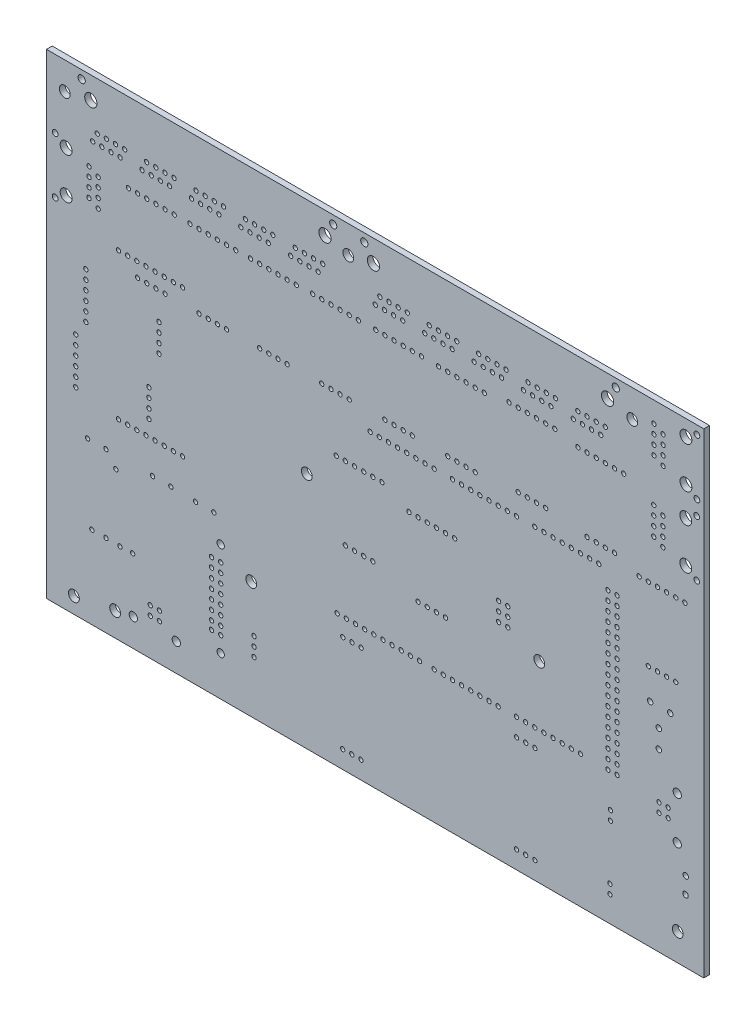
from build123d import *

# Parameters (mm, degrees)
MODEL_W             = 182.5400464
MODEL_H             = 132.08
MODEL_R             = 0.762
MODEL_R_2           = 0.6
MODEL_R_3           = 1.1500104
MODEL_R_4           = 0.999998
MODEL_R_5           = 0.7999984
MODEL_R_6           = 1.499997
MODEL_R_7           = 1.016
MODEL_R_8           = 1.6999966
MODEL_R_9           = 1.6500094
BOSS_EXTRUDE1_DEPTH = 1.6


with BuildPart() as part:
    # Model → Boss-Extrude1 (new body)
    with BuildSketch(Plane.XY):
        with Locations((88.7300232, -66.04)):
            Rectangle(MODEL_W, MODEL_H)
        with Locations((175.0000056, -109.99978)):
            Circle(MODEL_R, mode=Mode.SUBTRACT)
        with Locations((21.3998048, -109.2496926)):
            Circle(MODEL_R_2, mode=Mode.SUBTRACT)
        with Locations((10.0742242, -109.2244196)):
            Circle(MODEL_R_2, mode=Mode.SUBTRACT)
        with Locations((13.9749022, -109.2495402)):
            Circle(MODEL_R_2, mode=Mode.SUBTRACT)
        with Locations((165.1, -73.025)):
            Circle(MODEL_R, mode=Mode.SUBTRACT)
        with Locations((43.307, -99.187)):
            Circle(MODEL_R_2, mode=Mode.SUBTRACT)
        with Locations((43.307, -101.727)):
            Circle(MODEL_R_2, mode=Mode.SUBTRACT)
        with Locations((43.307, -104.267)):
            Circle(MODEL_R_2, mode=Mode.SUBTRACT)
        with Locations((43.307, -106.807)):
            Circle(MODEL_R_2, mode=Mode.SUBTRACT)
        with Locations((43.307, -109.347)):
            Circle(MODEL_R_2, mode=Mode.SUBTRACT)
        with Locations((43.307, -111.887)):
            Circle(MODEL_R_2, mode=Mode.SUBTRACT)
        with Locations((43.307, -114.427)):
            Circle(MODEL_R_2, mode=Mode.SUBTRACT)
        with Locations((43.307, -116.713)):
            Circle(MODEL_R_2, mode=Mode.SUBTRACT)
        with Locations((45.847, -99.187)):
            Circle(MODEL_R_2, mode=Mode.SUBTRACT)
        with Locations((45.847, -101.727)):
            Circle(MODEL_R_2, mode=Mode.SUBTRACT)
        with Locations((45.847, -104.267)):
            Circle(MODEL_R_2, mode=Mode.SUBTRACT)
        with Locations((45.847, -106.807)):
            Circle(MODEL_R_2, mode=Mode.SUBTRACT)
        with Locations((45.847, -109.347)):
            Circle(MODEL_R_2, mode=Mode.SUBTRACT)
        with Locations((45.847, -111.887)):
            Circle(MODEL_R_2, mode=Mode.SUBTRACT)
        with Locations((45.847, -114.427)):
            Circle(MODEL_R_2, mode=Mode.SUBTRACT)
        with Locations((45.847, -116.713)):
            Circle(MODEL_R_2, mode=Mode.SUBTRACT)
        with Locations((19.99996, -78.994)):
            Circle(MODEL_R_2, mode=Mode.SUBTRACT)
        with Locations((22.53996, -78.994)):
            Circle(MODEL_R_2, mode=Mode.SUBTRACT)
        with Locations((25.07996, -78.994)):
            Circle(MODEL_R_2, mode=Mode.SUBTRACT)
        with Locations((27.61996, -78.994)):
            Circle(MODEL_R_2, mode=Mode.SUBTRACT)
        with Locations((30.15996, -78.994)):
            Circle(MODEL_R_2, mode=Mode.SUBTRACT)
        with Locations((32.69996, -78.994)):
            Circle(MODEL_R_2, mode=Mode.SUBTRACT)
        with Locations((35.23996, -78.994)):
            Circle(MODEL_R_2, mode=Mode.SUBTRACT)
        with Locations((19.99996, -38.354)):
            Circle(MODEL_R_2, mode=Mode.SUBTRACT)
        with Locations((22.53996, -38.354)):
            Circle(MODEL_R_2, mode=Mode.SUBTRACT)
        with Locations((25.07996, -38.354)):
            Circle(MODEL_R_2, mode=Mode.SUBTRACT)
        with Locations((27.61996, -38.354)):
            Circle(MODEL_R_2, mode=Mode.SUBTRACT)
        with Locations((30.15996, -38.354)):
            Circle(MODEL_R_2, mode=Mode.SUBTRACT)
        with Locations((32.69996, -38.354)):
            Circle(MODEL_R_2, mode=Mode.SUBTRACT)
        with Locations((35.23996, -38.354)):
            Circle(MODEL_R_2, mode=Mode.SUBTRACT)
        with Locations((167.513, -78.232)):
            Circle(MODEL_R, mode=Mode.SUBTRACT)
        with Locations((167.513, -83.312)):
            Circle(MODEL_R, mode=Mode.SUBTRACT)
        with Locations((135.598789, -47.0198704)):
            Circle(MODEL_R_2, mode=Mode.SUBTRACT)
        with Locations((138.138789, -47.0198704)):
            Circle(MODEL_R_2, mode=Mode.SUBTRACT)
        with Locations((140.678789, -47.0198704)):
            Circle(MODEL_R_2, mode=Mode.SUBTRACT)
        with Locations((143.218789, -47.0198704)):
            Circle(MODEL_R_2, mode=Mode.SUBTRACT)
        with Locations((145.758789, -47.0198704)):
            Circle(MODEL_R_2, mode=Mode.SUBTRACT)
        with Locations((148.298789, -47.0198704)):
            Circle(MODEL_R_2, mode=Mode.SUBTRACT)
        with Locations((150.838789, -47.0198704)):
            Circle(MODEL_R_2, mode=Mode.SUBTRACT)
        with Locations((133.058789, -47.0198704)):
            Circle(MODEL_R_2, mode=Mode.SUBTRACT)
        with Locations((130.518789, -95.2798704)):
            Circle(MODEL_R_2, mode=Mode.SUBTRACT)
        with Locations((133.058789, -95.2798704)):
            Circle(MODEL_R_2, mode=Mode.SUBTRACT)
        with Locations((135.598789, -95.2798704)):
            Circle(MODEL_R_2, mode=Mode.SUBTRACT)
        with Locations((138.138789, -95.2798704)):
            Circle(MODEL_R_2, mode=Mode.SUBTRACT)
        with Locations((140.678789, -95.2798704)):
            Circle(MODEL_R_2, mode=Mode.SUBTRACT)
        with Locations((143.218789, -95.2798704)):
            Circle(MODEL_R_2, mode=Mode.SUBTRACT)
        with Locations((145.758789, -95.2798704)):
            Circle(MODEL_R_2, mode=Mode.SUBTRACT)
        with Locations((127.978789, -95.2798704)):
            Circle(MODEL_R_2, mode=Mode.SUBTRACT)
        with Locations((112.738789, -47.0198704)):
            Circle(MODEL_R_2, mode=Mode.SUBTRACT)
        with Locations((115.278789, -47.0198704)):
            Circle(MODEL_R_2, mode=Mode.SUBTRACT)
        with Locations((117.818789, -47.0198704)):
            Circle(MODEL_R_2, mode=Mode.SUBTRACT)
        with Locations((120.358789, -47.0198704)):
            Circle(MODEL_R_2, mode=Mode.SUBTRACT)
        with Locations((122.898789, -47.0198704)):
            Circle(MODEL_R_2, mode=Mode.SUBTRACT)
        with Locations((125.438789, -47.0198704)):
            Circle(MODEL_R_2, mode=Mode.SUBTRACT)
        with Locations((127.978789, -47.0198704)):
            Circle(MODEL_R_2, mode=Mode.SUBTRACT)
        with Locations((110.198789, -47.0198704)):
            Circle(MODEL_R_2, mode=Mode.SUBTRACT)
        with Locations((107.658789, -95.2798704)):
            Circle(MODEL_R_2, mode=Mode.SUBTRACT)
        with Locations((110.198789, -95.2798704)):
            Circle(MODEL_R_2, mode=Mode.SUBTRACT)
        with Locations((112.738789, -95.2798704)):
            Circle(MODEL_R_2, mode=Mode.SUBTRACT)
        with Locations((115.278789, -95.2798704)):
            Circle(MODEL_R_2, mode=Mode.SUBTRACT)
        with Locations((117.818789, -95.2798704)):
            Circle(MODEL_R_2, mode=Mode.SUBTRACT)
        with Locations((120.358789, -95.2798704)):
            Circle(MODEL_R_2, mode=Mode.SUBTRACT)
        with Locations((122.898789, -95.2798704)):
            Circle(MODEL_R_2, mode=Mode.SUBTRACT)
        with Locations((105.118789, -95.2798704)):
            Circle(MODEL_R_2, mode=Mode.SUBTRACT)
        with Locations((85.814789, -95.2798704)):
            Circle(MODEL_R_2, mode=Mode.SUBTRACT)
        with Locations((88.354789, -95.2798704)):
            Circle(MODEL_R_2, mode=Mode.SUBTRACT)
        with Locations((90.894789, -95.2798704)):
            Circle(MODEL_R_2, mode=Mode.SUBTRACT)
        with Locations((93.434789, -95.2798704)):
            Circle(MODEL_R_2, mode=Mode.SUBTRACT)
        with Locations((95.974789, -95.2798704)):
            Circle(MODEL_R_2, mode=Mode.SUBTRACT)
        with Locations((98.514789, -95.2798704)):
            Circle(MODEL_R_2, mode=Mode.SUBTRACT)
        with Locations((101.054789, -95.2798704)):
            Circle(MODEL_R_2, mode=Mode.SUBTRACT)
        with Locations((83.274789, -95.2798704)):
            Circle(MODEL_R_2, mode=Mode.SUBTRACT)
        with Locations((155.918916, -74.959972)):
            Circle(MODEL_R_2, mode=Mode.SUBTRACT)
        with Locations((153.378916, -74.959972)):
            Circle(MODEL_R_2, mode=Mode.SUBTRACT)
        with Locations((155.918916, -77.499972)):
            Circle(MODEL_R_2, mode=Mode.SUBTRACT)
        with Locations((153.378916, -77.499972)):
            Circle(MODEL_R_2, mode=Mode.SUBTRACT)
        with Locations((155.918916, -80.039972)):
            Circle(MODEL_R_2, mode=Mode.SUBTRACT)
        with Locations((153.378916, -80.039972)):
            Circle(MODEL_R_2, mode=Mode.SUBTRACT)
        with Locations((155.918916, -82.579972)):
            Circle(MODEL_R_2, mode=Mode.SUBTRACT)
        with Locations((153.378916, -82.579972)):
            Circle(MODEL_R_2, mode=Mode.SUBTRACT)
        with Locations((155.918916, -85.119972)):
            Circle(MODEL_R_2, mode=Mode.SUBTRACT)
        with Locations((153.378916, -85.119972)):
            Circle(MODEL_R_2, mode=Mode.SUBTRACT)
        with Locations((155.918916, -87.659972)):
            Circle(MODEL_R_2, mode=Mode.SUBTRACT)
        with Locations((153.378916, -87.659972)):
            Circle(MODEL_R_2, mode=Mode.SUBTRACT)
        with Locations((155.918916, -90.199972)):
            Circle(MODEL_R_2, mode=Mode.SUBTRACT)
        with Locations((153.378916, -90.199972)):
            Circle(MODEL_R_2, mode=Mode.SUBTRACT)
        with Locations((155.918916, -92.739972)):
            Circle(MODEL_R_2, mode=Mode.SUBTRACT)
        with Locations((153.378916, -92.739972)):
            Circle(MODEL_R_2, mode=Mode.SUBTRACT)
        with Locations((155.918916, -54.639972)):
            Circle(MODEL_R_2, mode=Mode.SUBTRACT)
        with Locations((153.378916, -54.639972)):
            Circle(MODEL_R_2, mode=Mode.SUBTRACT)
        with Locations((155.918916, -57.179972)):
            Circle(MODEL_R_2, mode=Mode.SUBTRACT)
        with Locations((153.378916, -57.179972)):
            Circle(MODEL_R_2, mode=Mode.SUBTRACT)
        with Locations((155.918916, -59.719972)):
            Circle(MODEL_R_2, mode=Mode.SUBTRACT)
        with Locations((153.378916, -59.719972)):
            Circle(MODEL_R_2, mode=Mode.SUBTRACT)
        with Locations((155.918916, -62.259972)):
            Circle(MODEL_R_2, mode=Mode.SUBTRACT)
        with Locations((153.378916, -62.259972)):
            Circle(MODEL_R_2, mode=Mode.SUBTRACT)
        with Locations((155.918916, -64.799972)):
            Circle(MODEL_R_2, mode=Mode.SUBTRACT)
        with Locations((153.378916, -64.799972)):
            Circle(MODEL_R_2, mode=Mode.SUBTRACT)
        with Locations((155.918916, -67.339972)):
            Circle(MODEL_R_2, mode=Mode.SUBTRACT)
        with Locations((153.378916, -67.339972)):
            Circle(MODEL_R_2, mode=Mode.SUBTRACT)
        with Locations((155.918916, -69.879972)):
            Circle(MODEL_R_2, mode=Mode.SUBTRACT)
        with Locations((153.378916, -69.879972)):
            Circle(MODEL_R_2, mode=Mode.SUBTRACT)
        with Locations((155.918916, -72.419972)):
            Circle(MODEL_R_2, mode=Mode.SUBTRACT)
        with Locations((153.378916, -72.419972)):
            Circle(MODEL_R_2, mode=Mode.SUBTRACT)
        with Locations((153.378789, -52.0998704)):
            Circle(MODEL_R_2, mode=Mode.SUBTRACT)
        with Locations((155.918789, -52.0998704)):
            Circle(MODEL_R_2, mode=Mode.SUBTRACT)
        with Locations((153.378789, -95.2798704)):
            Circle(MODEL_R_2, mode=Mode.SUBTRACT)
        with Locations((155.918789, -95.2798704)):
            Circle(MODEL_R_2, mode=Mode.SUBTRACT)
        with Locations((92.418789, -47.0198704)):
            Circle(MODEL_R_2, mode=Mode.SUBTRACT)
        with Locations((94.958789, -47.0198704)):
            Circle(MODEL_R_2, mode=Mode.SUBTRACT)
        with Locations((97.498789, -47.0198704)):
            Circle(MODEL_R_2, mode=Mode.SUBTRACT)
        with Locations((100.038789, -47.0198704)):
            Circle(MODEL_R_2, mode=Mode.SUBTRACT)
        with Locations((102.578789, -47.0198704)):
            Circle(MODEL_R_2, mode=Mode.SUBTRACT)
        with Locations((105.118789, -47.0198704)):
            Circle(MODEL_R_2, mode=Mode.SUBTRACT)
        with Locations((80.734789, -95.2798704)):
            Circle(MODEL_R_2, mode=Mode.SUBTRACT)
        with Locations((78.194789, -95.2798704)):
            Circle(MODEL_R_2, mode=Mode.SUBTRACT)
        with Locations((87.338789, -47.0198704)):
            Circle(MODEL_R_2, mode=Mode.SUBTRACT)
        with Locations((89.878789, -47.0198704)):
            Circle(MODEL_R_2, mode=Mode.SUBTRACT)
        with Locations((123.025789, -74.9598704)):
            Circle(MODEL_R_2, mode=Mode.SUBTRACT)
        with Locations((125.565789, -74.9598704)):
            Circle(MODEL_R_2, mode=Mode.SUBTRACT)
        with Locations((123.025789, -72.4198704)):
            Circle(MODEL_R_2, mode=Mode.SUBTRACT)
        with Locations((125.565789, -72.4198704)):
            Circle(MODEL_R_2, mode=Mode.SUBTRACT)
        with Locations((123.025789, -69.8798704)):
            Circle(MODEL_R_2, mode=Mode.SUBTRACT)
        with Locations((125.565789, -69.8798704)):
            Circle(MODEL_R_2, mode=Mode.SUBTRACT)
        with Locations((55.118, -117.348)):
            Circle(MODEL_R_2, mode=Mode.SUBTRACT)
        with Locations((55.118, -114.808)):
            Circle(MODEL_R_2, mode=Mode.SUBTRACT)
        with Locations((55.118, -112.268)):
            Circle(MODEL_R_2, mode=Mode.SUBTRACT)
        with Locations((154.073863065, -104.652526682)):
            Circle(MODEL_R_2, mode=Mode.SUBTRACT)
        with Locations((154.073863065, -107.192526682)):
            Circle(MODEL_R_2, mode=Mode.SUBTRACT)
        with Locations((153.946863065, -124.972526682)):
            Circle(MODEL_R_2, mode=Mode.SUBTRACT)
        with Locations((153.946863065, -122.432526682)):
            Circle(MODEL_R_2, mode=Mode.SUBTRACT)
        with Locations((127.993533681, -127.161364817)):
            Circle(MODEL_R_2, mode=Mode.SUBTRACT)
        with Locations((130.533533681, -127.161364817)):
            Circle(MODEL_R_2, mode=Mode.SUBTRACT)
        with Locations((133.096, -127.159)):
            Circle(MODEL_R_2, mode=Mode.SUBTRACT)
        with Locations((133.096, -100.203)):
            Circle(MODEL_R_2, mode=Mode.SUBTRACT)
        with Locations((130.556, -100.203)):
            Circle(MODEL_R_2, mode=Mode.SUBTRACT)
        with Locations((128.016, -100.203)):
            Circle(MODEL_R_2, mode=Mode.SUBTRACT)
        with Locations((84.788420472, -127.165668365)):
            Circle(MODEL_R_2, mode=Mode.SUBTRACT)
        with Locations((82.248420472, -127.165668365)):
            Circle(MODEL_R_2, mode=Mode.SUBTRACT)
        with Locations((79.708420472, -127.165668365)):
            Circle(MODEL_R_2, mode=Mode.SUBTRACT)
        with Locations((84.836, -100.203)):
            Circle(MODEL_R_2, mode=Mode.SUBTRACT)
        with Locations((82.296, -100.203)):
            Circle(MODEL_R_2, mode=Mode.SUBTRACT)
        with Locations((79.756, -100.203)):
            Circle(MODEL_R_2, mode=Mode.SUBTRACT)
        with Locations((43.942, -88.138)):
            Circle(MODEL_R_2, mode=Mode.SUBTRACT)
        with Locations((38.862, -88.138)):
            Circle(MODEL_R_2, mode=Mode.SUBTRACT)
        with Locations((170.0996598, -98.5698054)):
            Circle(MODEL_R_2, mode=Mode.SUBTRACT)
        with Locations((167.5596598, -98.5698054)):
            Circle(MODEL_R_2, mode=Mode.SUBTRACT)
        with Locations((170.0996598, -96.0298054)):
            Circle(MODEL_R_2, mode=Mode.SUBTRACT)
        with Locations((172.6396598, -91.3308054)):
            Circle(MODEL_R_3, mode=Mode.SUBTRACT)
        with Locations((172.6396598, -103.2688054)):
            Circle(MODEL_R_3, mode=Mode.SUBTRACT)
        with Locations((26.279856, -121.82475)):
            Circle(MODEL_R_2, mode=Mode.SUBTRACT)
        with Locations((26.2799576, -119.28475)):
            Circle(MODEL_R_2, mode=Mode.SUBTRACT)
        with Locations((28.8199576, -121.82475)):
            Circle(MODEL_R_2, mode=Mode.SUBTRACT)
        with Locations((33.5189576, -124.36475)):
            Circle(MODEL_R_3, mode=Mode.SUBTRACT)
        with Locations((21.5809576, -124.36475)):
            Circle(MODEL_R_3, mode=Mode.SUBTRACT)
        with Locations((8.89, -87.884)):
            Circle(MODEL_R_2, mode=Mode.SUBTRACT)
        with Locations((13.97, -87.884)):
            Circle(MODEL_R_2, mode=Mode.SUBTRACT)
        with Locations((26.924, -87.884)):
            Circle(MODEL_R_2, mode=Mode.SUBTRACT)
        with Locations((32.004, -87.884)):
            Circle(MODEL_R_2, mode=Mode.SUBTRACT)
        with Locations((10.2869492, -15.7478984)):
            Circle(MODEL_R_2, mode=Mode.SUBTRACT)
        with Locations((11.5569492, -13.2078984)):
            Circle(MODEL_R_2, mode=Mode.SUBTRACT)
        with Locations((12.8269492, -15.7478984)):
            Circle(MODEL_R_2, mode=Mode.SUBTRACT)
        with Locations((14.0969492, -13.2078984)):
            Circle(MODEL_R_2, mode=Mode.SUBTRACT)
        with Locations((15.3669492, -15.7478984)):
            Circle(MODEL_R_2, mode=Mode.SUBTRACT)
        with Locations((16.6369492, -13.2078984)):
            Circle(MODEL_R_2, mode=Mode.SUBTRACT)
        with Locations((17.9069492, -15.7478984)):
            Circle(MODEL_R_2, mode=Mode.SUBTRACT)
        with Locations((19.1769492, -13.2078984)):
            Circle(MODEL_R_2, mode=Mode.SUBTRACT)
        with Locations((24.0029492, -15.7478984)):
            Circle(MODEL_R_2, mode=Mode.SUBTRACT)
        with Locations((25.2729492, -13.2078984)):
            Circle(MODEL_R_2, mode=Mode.SUBTRACT)
        with Locations((26.5429492, -15.7478984)):
            Circle(MODEL_R_2, mode=Mode.SUBTRACT)
        with Locations((27.8129492, -13.2078984)):
            Circle(MODEL_R_2, mode=Mode.SUBTRACT)
        with Locations((29.083, -15.748)):
            Circle(MODEL_R_2, mode=Mode.SUBTRACT)
        with Locations((30.3529492, -13.2078984)):
            Circle(MODEL_R_2, mode=Mode.SUBTRACT)
        with Locations((31.6229492, -15.7478984)):
            Circle(MODEL_R_2, mode=Mode.SUBTRACT)
        with Locations((32.8929492, -13.2078984)):
            Circle(MODEL_R_2, mode=Mode.SUBTRACT)
        with Locations((37.7189492, -15.7478984)):
            Circle(MODEL_R_2, mode=Mode.SUBTRACT)
        with Locations((38.9889492, -13.2078984)):
            Circle(MODEL_R_2, mode=Mode.SUBTRACT)
        with Locations((40.2589492, -15.7478984)):
            Circle(MODEL_R_2, mode=Mode.SUBTRACT)
        with Locations((41.5289492, -13.2078984)):
            Circle(MODEL_R_2, mode=Mode.SUBTRACT)
        with Locations((42.7989492, -15.7478984)):
            Circle(MODEL_R_2, mode=Mode.SUBTRACT)
        with Locations((44.0689492, -13.2078984)):
            Circle(MODEL_R_2, mode=Mode.SUBTRACT)
        with Locations((45.3389492, -15.7478984)):
            Circle(MODEL_R_2, mode=Mode.SUBTRACT)
        with Locations((46.6089492, -13.2078984)):
            Circle(MODEL_R_2, mode=Mode.SUBTRACT)
        with Locations((51.4349492, -15.7478984)):
            Circle(MODEL_R_2, mode=Mode.SUBTRACT)
        with Locations((52.7049492, -13.2078984)):
            Circle(MODEL_R_2, mode=Mode.SUBTRACT)
        with Locations((53.9749492, -15.7478984)):
            Circle(MODEL_R_2, mode=Mode.SUBTRACT)
        with Locations((55.2449492, -13.2078984)):
            Circle(MODEL_R_2, mode=Mode.SUBTRACT)
        with Locations((56.5149492, -15.7478984)):
            Circle(MODEL_R_2, mode=Mode.SUBTRACT)
        with Locations((57.7849492, -13.2078984)):
            Circle(MODEL_R_2, mode=Mode.SUBTRACT)
        with Locations((59.0549492, -15.7478984)):
            Circle(MODEL_R_2, mode=Mode.SUBTRACT)
        with Locations((60.3249492, -13.2078984)):
            Circle(MODEL_R_2, mode=Mode.SUBTRACT)
        with Locations((7.2389492, -2.2858984)):
            Circle(MODEL_R_4, mode=Mode.SUBTRACT)
        with Locations((77.0889492, -2.2858984)):
            Circle(MODEL_R_4, mode=Mode.SUBTRACT)
        with Locations((74.1679746, -13.208)):
            Circle(MODEL_R_2, mode=Mode.SUBTRACT)
        with Locations((72.8979746, -15.748)):
            Circle(MODEL_R_2, mode=Mode.SUBTRACT)
        with Locations((71.6279746, -13.208)):
            Circle(MODEL_R_2, mode=Mode.SUBTRACT)
        with Locations((70.3579746, -15.748)):
            Circle(MODEL_R_2, mode=Mode.SUBTRACT)
        with Locations((69.0879746, -13.208)):
            Circle(MODEL_R_2, mode=Mode.SUBTRACT)
        with Locations((67.8179746, -15.748)):
            Circle(MODEL_R_2, mode=Mode.SUBTRACT)
        with Locations((66.5479746, -13.208)):
            Circle(MODEL_R_2, mode=Mode.SUBTRACT)
        with Locations((65.2779746, -15.748)):
            Circle(MODEL_R_2, mode=Mode.SUBTRACT)
        with Locations((88.7729492, -15.7478984)):
            Circle(MODEL_R_2, mode=Mode.SUBTRACT)
        with Locations((90.0429492, -13.2078984)):
            Circle(MODEL_R_2, mode=Mode.SUBTRACT)
        with Locations((91.3129492, -15.7478984)):
            Circle(MODEL_R_2, mode=Mode.SUBTRACT)
        with Locations((92.5829492, -13.2078984)):
            Circle(MODEL_R_2, mode=Mode.SUBTRACT)
        with Locations((93.8529492, -15.7478984)):
            Circle(MODEL_R_2, mode=Mode.SUBTRACT)
        with Locations((95.1229492, -13.2078984)):
            Circle(MODEL_R_2, mode=Mode.SUBTRACT)
        with Locations((96.3929492, -15.7478984)):
            Circle(MODEL_R_2, mode=Mode.SUBTRACT)
        with Locations((97.6629492, -13.2078984)):
            Circle(MODEL_R_2, mode=Mode.SUBTRACT)
        with Locations((102.4889492, -15.7478984)):
            Circle(MODEL_R_2, mode=Mode.SUBTRACT)
        with Locations((103.7589492, -13.2078984)):
            Circle(MODEL_R_2, mode=Mode.SUBTRACT)
        with Locations((105.0289492, -15.7478984)):
            Circle(MODEL_R_2, mode=Mode.SUBTRACT)
        with Locations((106.2989492, -13.2078984)):
            Circle(MODEL_R_2, mode=Mode.SUBTRACT)
        with Locations((107.5689492, -15.7478984)):
            Circle(MODEL_R_2, mode=Mode.SUBTRACT)
        with Locations((108.8389492, -13.2078984)):
            Circle(MODEL_R_2, mode=Mode.SUBTRACT)
        with Locations((110.1089492, -15.7478984)):
            Circle(MODEL_R_2, mode=Mode.SUBTRACT)
        with Locations((111.3789492, -13.2078984)):
            Circle(MODEL_R_2, mode=Mode.SUBTRACT)
        with Locations((116.2049492, -15.7478984)):
            Circle(MODEL_R_2, mode=Mode.SUBTRACT)
        with Locations((117.4749492, -13.2078984)):
            Circle(MODEL_R_2, mode=Mode.SUBTRACT)
        with Locations((118.7449492, -15.7478984)):
            Circle(MODEL_R_2, mode=Mode.SUBTRACT)
        with Locations((120.0149492, -13.2078984)):
            Circle(MODEL_R_2, mode=Mode.SUBTRACT)
        with Locations((121.2849492, -15.7478984)):
            Circle(MODEL_R_2, mode=Mode.SUBTRACT)
        with Locations((122.5549492, -13.2078984)):
            Circle(MODEL_R_2, mode=Mode.SUBTRACT)
        with Locations((123.8249492, -15.7478984)):
            Circle(MODEL_R_2, mode=Mode.SUBTRACT)
        with Locations((125.0949492, -13.2078984)):
            Circle(MODEL_R_2, mode=Mode.SUBTRACT)
        with Locations((129.9209492, -15.7478984)):
            Circle(MODEL_R_2, mode=Mode.SUBTRACT)
        with Locations((131.1909492, -13.2078984)):
            Circle(MODEL_R_2, mode=Mode.SUBTRACT)
        with Locations((132.4609492, -15.7478984)):
            Circle(MODEL_R_2, mode=Mode.SUBTRACT)
        with Locations((133.7309492, -13.2078984)):
            Circle(MODEL_R_2, mode=Mode.SUBTRACT)
        with Locations((135.0009492, -15.7478984)):
            Circle(MODEL_R_2, mode=Mode.SUBTRACT)
        with Locations((136.2709492, -13.2078984)):
            Circle(MODEL_R_2, mode=Mode.SUBTRACT)
        with Locations((137.5409492, -15.7478984)):
            Circle(MODEL_R_2, mode=Mode.SUBTRACT)
        with Locations((138.8109492, -13.2078984)):
            Circle(MODEL_R_2, mode=Mode.SUBTRACT)
        with Locations((85.7249492, -2.2858984)):
            Circle(MODEL_R_4, mode=Mode.SUBTRACT)
        with Locations((155.5749492, -2.2858984)):
            Circle(MODEL_R_4, mode=Mode.SUBTRACT)
        with Locations((152.6539746, -13.208)):
            Circle(MODEL_R_2, mode=Mode.SUBTRACT)
        with Locations((151.3839746, -15.748)):
            Circle(MODEL_R_2, mode=Mode.SUBTRACT)
        with Locations((150.1139746, -13.208)):
            Circle(MODEL_R_2, mode=Mode.SUBTRACT)
        with Locations((148.8439746, -15.748)):
            Circle(MODEL_R_2, mode=Mode.SUBTRACT)
        with Locations((147.5739746, -13.208)):
            Circle(MODEL_R_2, mode=Mode.SUBTRACT)
        with Locations((146.3039746, -15.748)):
            Circle(MODEL_R_2, mode=Mode.SUBTRACT)
        with Locations((145.0339746, -13.208)):
            Circle(MODEL_R_2, mode=Mode.SUBTRACT)
        with Locations((143.7639746, -15.748)):
            Circle(MODEL_R_2, mode=Mode.SUBTRACT)
        with Locations((168.6946334, -14.5699734)):
            Circle(MODEL_R_2, mode=Mode.SUBTRACT)
        with Locations((166.1546334, -13.2999734)):
            Circle(MODEL_R_2, mode=Mode.SUBTRACT)
        with Locations((168.6946334, -12.0299734)):
            Circle(MODEL_R_2, mode=Mode.SUBTRACT)
        with Locations((166.1546334, -10.7599734)):
            Circle(MODEL_R_2, mode=Mode.SUBTRACT)
        with Locations((168.6946334, -9.4899734)):
            Circle(MODEL_R_2, mode=Mode.SUBTRACT)
        with Locations((166.1546334, -8.2199734)):
            Circle(MODEL_R_2, mode=Mode.SUBTRACT)
        with Locations((168.6946334, -6.9499734)):
            Circle(MODEL_R_2, mode=Mode.SUBTRACT)
        with Locations((166.1546334, -5.6799734)):
            Circle(MODEL_R_2, mode=Mode.SUBTRACT)
        with Locations((178.09464, -2.3749762)):
            Circle(MODEL_R_5, mode=Mode.SUBTRACT)
        with Locations((178.09464, -17.8749706)):
            Circle(MODEL_R_5, mode=Mode.SUBTRACT)
        with Locations((168.6446462, -34.1449406)):
            Circle(MODEL_R_2, mode=Mode.SUBTRACT)
        with Locations((166.1046462, -32.8749406)):
            Circle(MODEL_R_2, mode=Mode.SUBTRACT)
        with Locations((168.6446462, -31.6049406)):
            Circle(MODEL_R_2, mode=Mode.SUBTRACT)
        with Locations((166.1046462, -30.3349406)):
            Circle(MODEL_R_2, mode=Mode.SUBTRACT)
        with Locations((168.6446462, -29.0649406)):
            Circle(MODEL_R_2, mode=Mode.SUBTRACT)
        with Locations((166.1046462, -27.7949406)):
            Circle(MODEL_R_2, mode=Mode.SUBTRACT)
        with Locations((168.6446462, -26.5249406)):
            Circle(MODEL_R_2, mode=Mode.SUBTRACT)
        with Locations((166.1046462, -25.2549406)):
            Circle(MODEL_R_2, mode=Mode.SUBTRACT)
        with Locations((178.0446528, -21.9499434)):
            Circle(MODEL_R_5, mode=Mode.SUBTRACT)
        with Locations((178.0446528, -37.4499378)):
            Circle(MODEL_R_5, mode=Mode.SUBTRACT)
        with Locations((9.272016, -22.225)):
            Circle(MODEL_R_2, mode=Mode.SUBTRACT)
        with Locations((11.812016, -23.495)):
            Circle(MODEL_R_2, mode=Mode.SUBTRACT)
        with Locations((9.272016, -24.765)):
            Circle(MODEL_R_2, mode=Mode.SUBTRACT)
        with Locations((11.812016, -26.035)):
            Circle(MODEL_R_2, mode=Mode.SUBTRACT)
        with Locations((9.272016, -27.305)):
            Circle(MODEL_R_2, mode=Mode.SUBTRACT)
        with Locations((11.812016, -28.575)):
            Circle(MODEL_R_2, mode=Mode.SUBTRACT)
        with Locations((9.272016, -29.845)):
            Circle(MODEL_R_2, mode=Mode.SUBTRACT)
        with Locations((11.812016, -31.115)):
            Circle(MODEL_R_2, mode=Mode.SUBTRACT)
        with Locations((-0.1279906, -34.4199972)):
            Circle(MODEL_R_5, mode=Mode.SUBTRACT)
        with Locations((-0.1279906, -18.9200028)):
            Circle(MODEL_R_5, mode=Mode.SUBTRACT)
        with Locations((28.7199832, -52.4799052)):
            Circle(MODEL_R_2, mode=Mode.SUBTRACT)
        with Locations((28.7199832, -55.0199052)):
            Circle(MODEL_R_2, mode=Mode.SUBTRACT)
        with Locations((28.7199832, -57.5599052)):
            Circle(MODEL_R_2, mode=Mode.SUBTRACT)
        with Locations((8.3999832, -47.3999052)):
            Circle(MODEL_R_2, mode=Mode.SUBTRACT)
        with Locations((8.3999832, -49.9399052)):
            Circle(MODEL_R_2, mode=Mode.SUBTRACT)
        with Locations((8.3999832, -52.4799052)):
            Circle(MODEL_R_2, mode=Mode.SUBTRACT)
        with Locations((8.3999832, -55.0199052)):
            Circle(MODEL_R_2, mode=Mode.SUBTRACT)
        with Locations((8.3999832, -57.5599052)):
            Circle(MODEL_R_2, mode=Mode.SUBTRACT)
        with Locations((27.8449278, -42.319956)):
            Circle(MODEL_R_2, mode=Mode.SUBTRACT)
        with Locations((25.3049278, -42.319956)):
            Circle(MODEL_R_2, mode=Mode.SUBTRACT)
        with Locations((22.7649278, -42.319956)):
            Circle(MODEL_R_2, mode=Mode.SUBTRACT)
        with Locations((32.9249278, -21.999956)):
            Circle(MODEL_R_2, mode=Mode.SUBTRACT)
        with Locations((30.3849278, -21.999956)):
            Circle(MODEL_R_2, mode=Mode.SUBTRACT)
        with Locations((27.8449278, -21.999956)):
            Circle(MODEL_R_2, mode=Mode.SUBTRACT)
        with Locations((25.3049278, -21.999956)):
            Circle(MODEL_R_2, mode=Mode.SUBTRACT)
        with Locations((22.7649278, -21.999956)):
            Circle(MODEL_R_2, mode=Mode.SUBTRACT)
        with Locations((44.9199, -42.3449496)):
            Circle(MODEL_R_2, mode=Mode.SUBTRACT)
        with Locations((42.3799, -42.3449496)):
            Circle(MODEL_R_2, mode=Mode.SUBTRACT)
        with Locations((39.8399, -42.3449496)):
            Circle(MODEL_R_2, mode=Mode.SUBTRACT)
        with Locations((49.9999, -22.0249496)):
            Circle(MODEL_R_2, mode=Mode.SUBTRACT)
        with Locations((47.4599, -22.0249496)):
            Circle(MODEL_R_2, mode=Mode.SUBTRACT)
        with Locations((44.9199, -22.0249496)):
            Circle(MODEL_R_2, mode=Mode.SUBTRACT)
        with Locations((42.3799, -22.0249496)):
            Circle(MODEL_R_2, mode=Mode.SUBTRACT)
        with Locations((39.8399, -22.0249496)):
            Circle(MODEL_R_2, mode=Mode.SUBTRACT)
        with Locations((61.74486, -42.2949624)):
            Circle(MODEL_R_2, mode=Mode.SUBTRACT)
        with Locations((59.20486, -42.2949624)):
            Circle(MODEL_R_2, mode=Mode.SUBTRACT)
        with Locations((56.66486, -42.2949624)):
            Circle(MODEL_R_2, mode=Mode.SUBTRACT)
        with Locations((66.82486, -21.9749624)):
            Circle(MODEL_R_2, mode=Mode.SUBTRACT)
        with Locations((64.28486, -21.9749624)):
            Circle(MODEL_R_2, mode=Mode.SUBTRACT)
        with Locations((61.74486, -21.9749624)):
            Circle(MODEL_R_2, mode=Mode.SUBTRACT)
        with Locations((59.20486, -21.9749624)):
            Circle(MODEL_R_2, mode=Mode.SUBTRACT)
        with Locations((56.66486, -21.9749624)):
            Circle(MODEL_R_2, mode=Mode.SUBTRACT)
        with Locations((78.9948382, -42.169969)):
            Circle(MODEL_R_2, mode=Mode.SUBTRACT)
        with Locations((76.4548382, -42.169969)):
            Circle(MODEL_R_2, mode=Mode.SUBTRACT)
        with Locations((73.9148382, -42.169969)):
            Circle(MODEL_R_2, mode=Mode.SUBTRACT)
        with Locations((84.0748382, -21.849969)):
            Circle(MODEL_R_2, mode=Mode.SUBTRACT)
        with Locations((81.5348382, -21.849969)):
            Circle(MODEL_R_2, mode=Mode.SUBTRACT)
        with Locations((78.9948382, -21.849969)):
            Circle(MODEL_R_2, mode=Mode.SUBTRACT)
        with Locations((76.4548382, -21.849969)):
            Circle(MODEL_R_2, mode=Mode.SUBTRACT)
        with Locations((73.9148382, -21.849969)):
            Circle(MODEL_R_2, mode=Mode.SUBTRACT)
        with Locations((96.5197968, -42.0699692)):
            Circle(MODEL_R_2, mode=Mode.SUBTRACT)
        with Locations((93.9797968, -42.0699692)):
            Circle(MODEL_R_2, mode=Mode.SUBTRACT)
        with Locations((91.4397968, -42.0699692)):
            Circle(MODEL_R_2, mode=Mode.SUBTRACT)
        with Locations((101.5997968, -21.7499692)):
            Circle(MODEL_R_2, mode=Mode.SUBTRACT)
        with Locations((99.0597968, -21.7499692)):
            Circle(MODEL_R_2, mode=Mode.SUBTRACT)
        with Locations((96.5197968, -21.7499692)):
            Circle(MODEL_R_2, mode=Mode.SUBTRACT)
        with Locations((93.9797968, -21.7499692)):
            Circle(MODEL_R_2, mode=Mode.SUBTRACT)
        with Locations((91.4397968, -21.7499692)):
            Circle(MODEL_R_2, mode=Mode.SUBTRACT)
        with Locations((113.9697746, -42.14495)):
            Circle(MODEL_R_2, mode=Mode.SUBTRACT)
        with Locations((111.4297746, -42.14495)):
            Circle(MODEL_R_2, mode=Mode.SUBTRACT)
        with Locations((108.8897746, -42.14495)):
            Circle(MODEL_R_2, mode=Mode.SUBTRACT)
        with Locations((119.0497746, -21.82495)):
            Circle(MODEL_R_2, mode=Mode.SUBTRACT)
        with Locations((116.5097746, -21.82495)):
            Circle(MODEL_R_2, mode=Mode.SUBTRACT)
        with Locations((113.9697746, -21.82495)):
            Circle(MODEL_R_2, mode=Mode.SUBTRACT)
        with Locations((111.4297746, -21.82495)):
            Circle(MODEL_R_2, mode=Mode.SUBTRACT)
        with Locations((108.8897746, -21.82495)):
            Circle(MODEL_R_2, mode=Mode.SUBTRACT)
        with Locations((85.5448124, -77.819885)):
            Circle(MODEL_R_2, mode=Mode.SUBTRACT)
        with Locations((83.0048124, -77.819885)):
            Circle(MODEL_R_2, mode=Mode.SUBTRACT)
        with Locations((80.4648124, -77.819885)):
            Circle(MODEL_R_2, mode=Mode.SUBTRACT)
        with Locations((90.6248124, -57.499885)):
            Circle(MODEL_R_2, mode=Mode.SUBTRACT)
        with Locations((88.0848124, -57.499885)):
            Circle(MODEL_R_2, mode=Mode.SUBTRACT)
        with Locations((85.5448124, -57.499885)):
            Circle(MODEL_R_2, mode=Mode.SUBTRACT)
        with Locations((83.0048124, -57.499885)):
            Circle(MODEL_R_2, mode=Mode.SUBTRACT)
        with Locations((80.4648124, -57.499885)):
            Circle(MODEL_R_2, mode=Mode.SUBTRACT)
        with Locations((133.5447164, -40.994965)):
            Circle(MODEL_R_2, mode=Mode.SUBTRACT)
        with Locations((131.0047164, -40.994965)):
            Circle(MODEL_R_2, mode=Mode.SUBTRACT)
        with Locations((128.4647164, -40.994965)):
            Circle(MODEL_R_2, mode=Mode.SUBTRACT)
        with Locations((138.6247164, -20.674965)):
            Circle(MODEL_R_2, mode=Mode.SUBTRACT)
        with Locations((136.0847164, -20.674965)):
            Circle(MODEL_R_2, mode=Mode.SUBTRACT)
        with Locations((133.5447164, -20.674965)):
            Circle(MODEL_R_2, mode=Mode.SUBTRACT)
        with Locations((131.0047164, -20.674965)):
            Circle(MODEL_R_2, mode=Mode.SUBTRACT)
        with Locations((128.4647164, -20.674965)):
            Circle(MODEL_R_2, mode=Mode.SUBTRACT)
        with Locations((105.744772, -81.2448718)):
            Circle(MODEL_R_2, mode=Mode.SUBTRACT)
        with Locations((103.204772, -81.2448718)):
            Circle(MODEL_R_2, mode=Mode.SUBTRACT)
        with Locations((100.664772, -81.2448718)):
            Circle(MODEL_R_2, mode=Mode.SUBTRACT)
        with Locations((110.824772, -60.9248718)):
            Circle(MODEL_R_2, mode=Mode.SUBTRACT)
        with Locations((108.284772, -60.9248718)):
            Circle(MODEL_R_2, mode=Mode.SUBTRACT)
        with Locations((105.744772, -60.9248718)):
            Circle(MODEL_R_2, mode=Mode.SUBTRACT)
        with Locations((103.204772, -60.9248718)):
            Circle(MODEL_R_2, mode=Mode.SUBTRACT)
        with Locations((100.664772, -60.9248718)):
            Circle(MODEL_R_2, mode=Mode.SUBTRACT)
        with Locations((152.6696972, -42.2199562)):
            Circle(MODEL_R_2, mode=Mode.SUBTRACT)
        with Locations((150.1296972, -42.2199562)):
            Circle(MODEL_R_2, mode=Mode.SUBTRACT)
        with Locations((147.5896972, -42.2199562)):
            Circle(MODEL_R_2, mode=Mode.SUBTRACT)
        with Locations((157.7496972, -21.8999562)):
            Circle(MODEL_R_2, mode=Mode.SUBTRACT)
        with Locations((155.2096972, -21.8999562)):
            Circle(MODEL_R_2, mode=Mode.SUBTRACT)
        with Locations((152.6696972, -21.8999562)):
            Circle(MODEL_R_2, mode=Mode.SUBTRACT)
        with Locations((150.1296972, -21.8999562)):
            Circle(MODEL_R_2, mode=Mode.SUBTRACT)
        with Locations((147.5896972, -21.8999562)):
            Circle(MODEL_R_2, mode=Mode.SUBTRACT)
        with Locations((169.672, -64.77)):
            Circle(MODEL_R_2, mode=Mode.SUBTRACT)
        with Locations((167.132, -64.77)):
            Circle(MODEL_R_2, mode=Mode.SUBTRACT)
        with Locations((164.592, -64.77)):
            Circle(MODEL_R_2, mode=Mode.SUBTRACT)
        with Locations((174.752, -44.45)):
            Circle(MODEL_R_2, mode=Mode.SUBTRACT)
        with Locations((172.212, -44.45)):
            Circle(MODEL_R_2, mode=Mode.SUBTRACT)
        with Locations((169.672, -44.45)):
            Circle(MODEL_R_2, mode=Mode.SUBTRACT)
        with Locations((167.132, -44.45)):
            Circle(MODEL_R_2, mode=Mode.SUBTRACT)
        with Locations((164.592, -44.45)):
            Circle(MODEL_R_2, mode=Mode.SUBTRACT)
        with Locations((25.908, -69.596)):
            Circle(MODEL_R_2, mode=Mode.SUBTRACT)
        with Locations((25.908, -72.136)):
            Circle(MODEL_R_2, mode=Mode.SUBTRACT)
        with Locations((25.908, -74.676)):
            Circle(MODEL_R_2, mode=Mode.SUBTRACT)
        with Locations((5.588, -64.516)):
            Circle(MODEL_R_2, mode=Mode.SUBTRACT)
        with Locations((5.588, -67.056)):
            Circle(MODEL_R_2, mode=Mode.SUBTRACT)
        with Locations((5.588, -69.596)):
            Circle(MODEL_R_2, mode=Mode.SUBTRACT)
        with Locations((5.588, -72.136)):
            Circle(MODEL_R_2, mode=Mode.SUBTRACT)
        with Locations((5.588, -74.676)):
            Circle(MODEL_R_2, mode=Mode.SUBTRACT)
        with Locations((17.8748436, -109.349286)):
            Circle(MODEL_R_2, mode=Mode.SUBTRACT)
        with Locations((174.924593, -114.5748026)):
            Circle(MODEL_R, mode=Mode.SUBTRACT)
        with Locations((170.6880508, -73.0249746)):
            Circle(MODEL_R, mode=Mode.SUBTRACT)
        with Locations((17.45996, -78.994)):
            Circle(MODEL_R_2, mode=Mode.SUBTRACT)
        with Locations((17.45996, -38.354)):
            Circle(MODEL_R_2, mode=Mode.SUBTRACT)
        with Locations((167.5596598, -96.0298054)):
            Circle(MODEL_R_2, mode=Mode.SUBTRACT)
        with Locations((28.8199576, -119.28475)):
            Circle(MODEL_R_2, mode=Mode.SUBTRACT)
        with Locations((28.7199832, -49.9399052)):
            Circle(MODEL_R_2, mode=Mode.SUBTRACT)
        with Locations((8.3999832, -60.0999052)):
            Circle(MODEL_R_2, mode=Mode.SUBTRACT)
        with Locations((30.3849278, -42.319956)):
            Circle(MODEL_R_2, mode=Mode.SUBTRACT)
        with Locations((20.2249278, -21.999956)):
            Circle(MODEL_R_2, mode=Mode.SUBTRACT)
        with Locations((47.4599, -42.3449496)):
            Circle(MODEL_R_2, mode=Mode.SUBTRACT)
        with Locations((37.2999, -22.0249496)):
            Circle(MODEL_R_2, mode=Mode.SUBTRACT)
        with Locations((64.28486, -42.2949624)):
            Circle(MODEL_R_2, mode=Mode.SUBTRACT)
        with Locations((54.12486, -21.9749624)):
            Circle(MODEL_R_2, mode=Mode.SUBTRACT)
        with Locations((81.5348382, -42.169969)):
            Circle(MODEL_R_2, mode=Mode.SUBTRACT)
        with Locations((71.3748382, -21.849969)):
            Circle(MODEL_R_2, mode=Mode.SUBTRACT)
        with Locations((99.0597968, -42.0699692)):
            Circle(MODEL_R_2, mode=Mode.SUBTRACT)
        with Locations((88.8997968, -21.7499692)):
            Circle(MODEL_R_2, mode=Mode.SUBTRACT)
        with Locations((116.5097746, -42.14495)):
            Circle(MODEL_R_2, mode=Mode.SUBTRACT)
        with Locations((106.3497746, -21.82495)):
            Circle(MODEL_R_2, mode=Mode.SUBTRACT)
        with Locations((88.0848124, -77.819885)):
            Circle(MODEL_R_2, mode=Mode.SUBTRACT)
        with Locations((77.9248124, -57.499885)):
            Circle(MODEL_R_2, mode=Mode.SUBTRACT)
        with Locations((136.0847164, -40.994965)):
            Circle(MODEL_R_2, mode=Mode.SUBTRACT)
        with Locations((125.9247164, -20.674965)):
            Circle(MODEL_R_2, mode=Mode.SUBTRACT)
        with Locations((108.284772, -81.2448718)):
            Circle(MODEL_R_2, mode=Mode.SUBTRACT)
        with Locations((98.124772, -60.9248718)):
            Circle(MODEL_R_2, mode=Mode.SUBTRACT)
        with Locations((155.2096972, -42.2199562)):
            Circle(MODEL_R_2, mode=Mode.SUBTRACT)
        with Locations((145.0496972, -21.8999562)):
            Circle(MODEL_R_2, mode=Mode.SUBTRACT)
        with Locations((172.212, -64.77)):
            Circle(MODEL_R_2, mode=Mode.SUBTRACT)
        with Locations((162.052, -44.45)):
            Circle(MODEL_R_2, mode=Mode.SUBTRACT)
        with Locations((25.908, -67.056)):
            Circle(MODEL_R_2, mode=Mode.SUBTRACT)
        with Locations((5.588, -77.216)):
            Circle(MODEL_R_2, mode=Mode.SUBTRACT)
        with Locations((54.349904, -99.574858)):
            Circle(MODEL_R_6, mode=Mode.SUBTRACT)
        with Locations((81.27492, -7.62508)):
            Circle(MODEL_R_6, mode=Mode.SUBTRACT)
        with Locations((5.08, -127.635)):
            Circle(MODEL_R_6, mode=Mode.SUBTRACT)
        with Locations((16.524224, -125.449076)):
            Circle(MODEL_R_6, mode=Mode.SUBTRACT)
        with Locations((16.724122, -91.323922)):
            Circle(MODEL_R_2, mode=Mode.SUBTRACT)
        with Locations((2.54, -7.62)):
            Circle(MODEL_R_6, mode=Mode.SUBTRACT)
        with Locations((160.149794, -7.675118)):
            Circle(MODEL_R_6, mode=Mode.SUBTRACT)
        with Locations((172.77461, -124.499878)):
            Circle(MODEL_R_6, mode=Mode.SUBTRACT)
        with Locations((69.749924, -65.924938)):
            Circle(MODEL_R_6, mode=Mode.SUBTRACT)
        with Locations((134.324852, -78.749906)):
            Circle(MODEL_R_6, mode=Mode.SUBTRACT)
        with Locations((45.847, -121.031)):
            Circle(MODEL_R_7, mode=Mode.SUBTRACT)
        with Locations((45.847, -94.869)):
            Circle(MODEL_R_7, mode=Mode.SUBTRACT)
        with Locations((74.803, -6.096)):
            Circle(MODEL_R_8, mode=Mode.SUBTRACT)
        with Locations((9.779, -6.096)):
            Circle(MODEL_R_8, mode=Mode.SUBTRACT)
        with Locations((153.289, -6.096)):
            Circle(MODEL_R_8, mode=Mode.SUBTRACT)
        with Locations((88.265, -6.096)):
            Circle(MODEL_R_8, mode=Mode.SUBTRACT)
        with Locations((175.044608, -4.409948)):
            Circle(MODEL_R_9, mode=Mode.SUBTRACT)
        with Locations((175.044608, -15.839948)):
            Circle(MODEL_R_9, mode=Mode.SUBTRACT)
        with Locations((174.99457, -23.984966)):
            Circle(MODEL_R_9, mode=Mode.SUBTRACT)
        with Locations((174.99457, -35.414966)):
            Circle(MODEL_R_9, mode=Mode.SUBTRACT)
        with Locations((2.922016, -32.385)):
            Circle(MODEL_R_9, mode=Mode.SUBTRACT)
        with Locations((2.922016, -20.955)):
            Circle(MODEL_R_9, mode=Mode.SUBTRACT)
    extrude(amount=BOSS_EXTRUDE1_DEPTH)


solid = part.part
